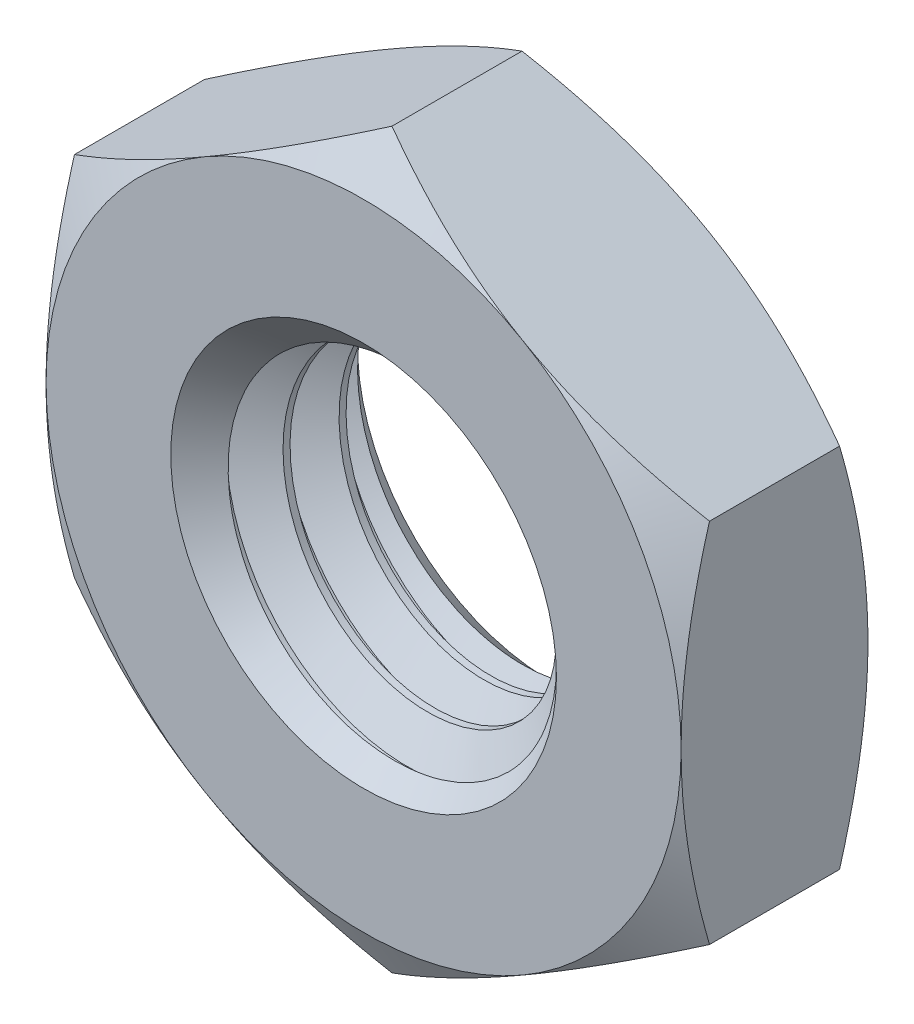
from build123d import *

# Parameters (mm, degrees)
BOSS_EXTRUDE1_START          = 2.5
SKETCH3_R                    = 5
BOSS_EXTRUDE1_DEPTH          = 5
CUT_EXTRUDE1_START           = 2.5
SKETCH4_OUTSIDE_W            = 82.218
SKETCH4_OUTSIDE_H            = 84.848
SKETCH4_OUTSIDE_R            = 8.5
CUT_EXTRUDE1_DEPTH           = 16.722455647
CUT_EXTRUDE1_DRAFT           = -60
CUT_EXTRUDE2_START           = -2.5
SKETCH5_OUTSIDE_W            = 82.218
SKETCH5_OUTSIDE_H            = 84.848
SKETCH5_OUTSIDE_R            = 8.5
CUT_EXTRUDE2_DEPTH           = 16.722455647
CUT_EXTRUDE2_DRAFT           = 60
SWEEP1_PITCH                 = 1.5
CUT_EXTRUDE3_START           = 2.5
SKETCH8_R                    = 5.162379763
CUT_EXTRUDE3_OTHER_WAY_DEPTH = 14.6000196
CUT_EXTRUDE3_OTHER_WAY_TAPER = -45
CUT_EXTRUDE4_START           = -2.5
SKETCH9_R                    = 5.162379763
CUT_EXTRUDE4_DEPTH           = 17.1000196
CUT_EXTRUDE4_TAPER           = 45
CUT_EXTRUDE4_OTHER_WAY_DEPTH = 14.6000196
CUT_EXTRUDE4_OTHER_WAY_TAPER = -45


with BuildPart() as part:
    # Sketch3 → Boss-Extrude1 (new body)
    with BuildSketch(Plane.XY.offset(BOSS_EXTRUDE1_START)):
        Polygon((-8.5, -4.907477288), (0, -9.814954576), (8.5, -4.907477288), (8.5, 4.907477288), (0, 9.814954576), (-8.5, 4.907477288), align=None)
        Circle(SKETCH3_R, mode=Mode.SUBTRACT)
    extrude(amount=-BOSS_EXTRUDE1_DEPTH)


with BuildPart() as cut_extrude1_tool:
    # Sketch4 outside → Cut-Extrude1 (with draft: the straight prism first)
    with BuildSketch(Plane.XY.offset(CUT_EXTRUDE1_START)):
        Rectangle(SKETCH4_OUTSIDE_W, SKETCH4_OUTSIDE_H)
        Circle(SKETCH4_OUTSIDE_R, mode=Mode.SUBTRACT)
    extrude(amount=-CUT_EXTRUDE1_DEPTH)
    # Cut-Extrude1: the draft: its side faces are tilted about the plane it starts from
    cut_extrude1_sides = [cut_extrude1_tool.faces().sort_by_distance(p)[0] for p in [
        (0, -42.424, -5.861227823),
        (41.109, 0, -5.861227823),
        (0, 42.424, -5.861227823),
        (-41.109, 0, -5.861227823),
        (-8.5, 0, -5.861227823),
    ]]
    draft(cut_extrude1_sides, Plane.XY.offset(CUT_EXTRUDE1_START), CUT_EXTRUDE1_DRAFT)


with BuildPart() as part_1:
    add(part.part)

    # Cut-Extrude1: cut by cut_extrude1_tool
    add(cut_extrude1_tool.part, mode=Mode.SUBTRACT)


with BuildPart() as cut_extrude2_tool:
    # Sketch5 outside → Cut-Extrude2 (with draft: the straight prism first)
    with BuildSketch(Plane.XY.offset(CUT_EXTRUDE2_START)):
        Rectangle(SKETCH5_OUTSIDE_W, SKETCH5_OUTSIDE_H)
        Circle(SKETCH5_OUTSIDE_R, mode=Mode.SUBTRACT)
    extrude(amount=CUT_EXTRUDE2_DEPTH)
    # Cut-Extrude2: the draft: its side faces are tilted about the plane it starts from
    cut_extrude2_sides = [cut_extrude2_tool.faces().sort_by_distance(p)[0] for p in [
        (0, -42.424, 5.861227823),
        (41.109, 0, 5.861227823),
        (0, 42.424, 5.861227823),
        (-41.109, 0, 5.861227823),
        (-8.5, 0, 5.861227823),
    ]]
    draft(cut_extrude2_sides, Plane.XY.offset(CUT_EXTRUDE2_START), CUT_EXTRUDE2_DRAFT)


with BuildPart() as part_2:
    add(part_1.part)

    # Cut-Extrude2: cut by cut_extrude2_tool
    add(cut_extrude2_tool.part, mode=Mode.SUBTRACT)

    # Sweep1: the profile of Sketch7 screwed along a right-hand helix of 4.333333 turns, 8 arcs to a turn; built about Z, then put on its axis
    sweep1_z = Axis((0, 0, 0), (0, 0, 1))
    sweep1_corners = [(5.081189882, 0, -1.359375), (4.025721421, 0, -0.75), (4.025721421, 0, -0.5625), (5.081189882, 0, 0.046875)]
    with BuildLine(mode=Mode.PRIVATE) as sweep1_profile:
        Line(sweep1_corners[0], sweep1_corners[1])
        Line(sweep1_corners[1], sweep1_corners[2])
        Line(sweep1_corners[2], sweep1_corners[3])
        Line(sweep1_corners[3], sweep1_corners[0])
    sweep1_cap = Face(sweep1_profile.wire())
    sweep1_turn_angles = [0, 22.5, 45, 67.5, 90, 112.5, 135, 157.5, 180, 202.5, 225, 247.5, 270, 292.5, 315, 337.5, 360]
    sweep1_turn_weights = [1, 0.9238795325112867, 1, 0.9238795325112867, 1, 0.9238795325112867, 1, 0.9238795325112867, 1, 0.9238795325112867, 1, 0.9238795325112867, 1, 0.9238795325112867, 1, 0.9238795325112867, 1]
    sweep1_turn_rails = [Edge.make_bspline([Vector(p[0], p[1], 0).rotate(sweep1_z, sweep1_turn_angles[k]) / sweep1_turn_weights[k] + Vector(0, 0, p[2] + SWEEP1_PITCH * sweep1_turn_angles[k] / 360) for k in range(17)], [0, 0, 0, 1, 1, 2, 2, 3, 3, 4, 4, 5, 5, 6, 6, 7, 7, 8, 8, 8], 2, sweep1_turn_weights) for p in sweep1_corners]
    sweep1_turn_sides = [Face.make_surface_from_curves(sweep1_turn_rails[p[0]], sweep1_turn_rails[p[1]]) for p in [(0, 1), (1, 2), (2, 3), (3, 0)]]
    sweep1_last_angles = [1440, 1462.5, 1485, 1507.5, 1530, 1545, 1560]
    sweep1_last_weights = [1, 0.9238795325112867, 1, 0.9238795325112867, 1, 0.9659258262890632, 1]
    sweep1_last_rails = [Edge.make_bspline([Vector(p[0], p[1], 0).rotate(sweep1_z, sweep1_last_angles[k]) / sweep1_last_weights[k] + Vector(0, 0, p[2] + SWEEP1_PITCH * sweep1_last_angles[k] / 360) for k in range(7)], [0, 0, 0, 1, 1, 2, 2, 3, 3, 3], 2, sweep1_last_weights) for p in sweep1_corners]
    sweep1_last_sides = [Face.make_surface_from_curves(sweep1_last_rails[p[0]], sweep1_last_rails[p[1]]) for p in [(0, 1), (1, 2), (2, 3), (3, 0)]]
    sweep1 = Plane(origin=(0, 0, 2.5), x_dir=(0, 1, 0), z_dir=(0, 0, -1)) * Solid(Shell([*[p.moved(Location((0, 0, SWEEP1_PITCH * i))) for i in range(4) for p in sweep1_turn_sides], *sweep1_last_sides, sweep1_cap, sweep1_cap.rotate(sweep1_z, 1560).moved(Location((0, 0, SWEEP1_PITCH * 1560 / 360)))]))
    add(sweep1)

    # Cut-Extrude3 cone 1 section (through the dimple's axis) → Cut-Extrude3 (revolve, cut)
    with BuildSketch(Plane(origin=(0, 0, 2.5), x_dir=(0, -1, 0), z_dir=(1, 0, 0))):
        Polygon((0, 0), (5.162379763, 0), (0, 5.162379763), align=None)
    revolve(axis=Axis((0, 0, 2.5), (0, 0, -1)), mode=Mode.SUBTRACT)

    # Sketch8 → Cut-Extrude3 other way (cut)
    with BuildSketch(Plane.XY.offset(CUT_EXTRUDE3_START)):
        Circle(SKETCH8_R)
    extrude(amount=CUT_EXTRUDE3_OTHER_WAY_DEPTH, taper=CUT_EXTRUDE3_OTHER_WAY_TAPER, mode=Mode.SUBTRACT)

    # Sketch9 → Cut-Extrude4 (cut)
    with BuildSketch(Plane.XY.offset(CUT_EXTRUDE4_START)):
        Circle(SKETCH9_R)
    extrude(amount=CUT_EXTRUDE4_DEPTH, taper=CUT_EXTRUDE4_TAPER, mode=Mode.SUBTRACT)

    # Sketch9 → Cut-Extrude4 other way (cut)
    with BuildSketch(Plane.XY.offset(CUT_EXTRUDE4_START)):
        Circle(SKETCH9_R)
    extrude(amount=-CUT_EXTRUDE4_OTHER_WAY_DEPTH, taper=CUT_EXTRUDE4_OTHER_WAY_TAPER, mode=Mode.SUBTRACT)


solid = part_2.part
